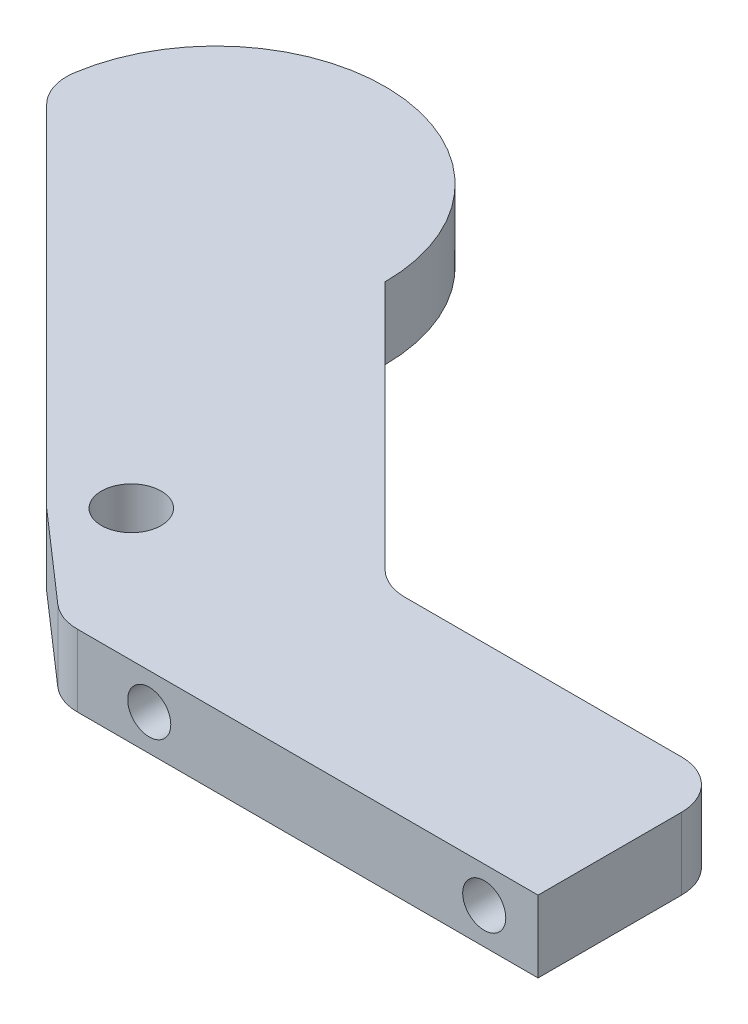
from build123d import *

# Parameters (mm, degrees)
SKETCH1_R           = 3.175
BOSS_EXTRUDE1_DEPTH = 3.81
SKETCH2_R           = 2.286
CUT_EXTRUDE1_DEPTH  = 5.08
FILLET1_R           = 5.08


with BuildPart() as part:
    # Sketch1 → Boss-Extrude1 (new, symmetric)
    with BuildSketch(Plane(origin=(0, 0, 0), x_dir=(1, 0, 0), z_dir=(0, 1, 0))):
        with BuildLine():
            Line((-43.270256121, 34.29), (-4.490128061, -4.490128061))
            Line((-4.490128061, -4.490128061), (6.35, -13.97))
            Line((6.35, -13.97), (57.15, -13.97))
            Line((57.15, -13.97), (57.15, 6.35))
            Line((57.15, 6.35), (20.590768363, 6.35))
            Line((20.590768363, 6.35), (-7.349231637, 34.29))
            ThreePointArc((-7.349231637, 34.29), (-25.309743879, 52.250512242), (-43.270256121, 34.29))
        make_face()
        Circle(SKETCH1_R, mode=Mode.SUBTRACT)
    extrude(amount=BOSS_EXTRUDE1_DEPTH, both=True)

    # Sketch2 → Cut-Extrude1 (cut)
    with BuildSketch(Plane.XY.offset(13.97)):
        with Locations((51.437940654, 0)):
            Circle(SKETCH2_R)
        with Locations((15.877940654, 0)):
            Circle(SKETCH2_R)
    extrude(amount=-CUT_EXTRUDE1_DEPTH, mode=Mode.SUBTRACT)

    # Fillet1
    fillet1_edges = [part.edges().sort_by_distance(p)[0] for p in [
        (57.15, 0, -6.35),
        (20.590768363, 0, -6.35),
        (6.35, 0, 13.97),
        (-43.270256121, 0, -34.29),
    ]]
    fillet(fillet1_edges, radius=FILLET1_R)


solid = part.part
